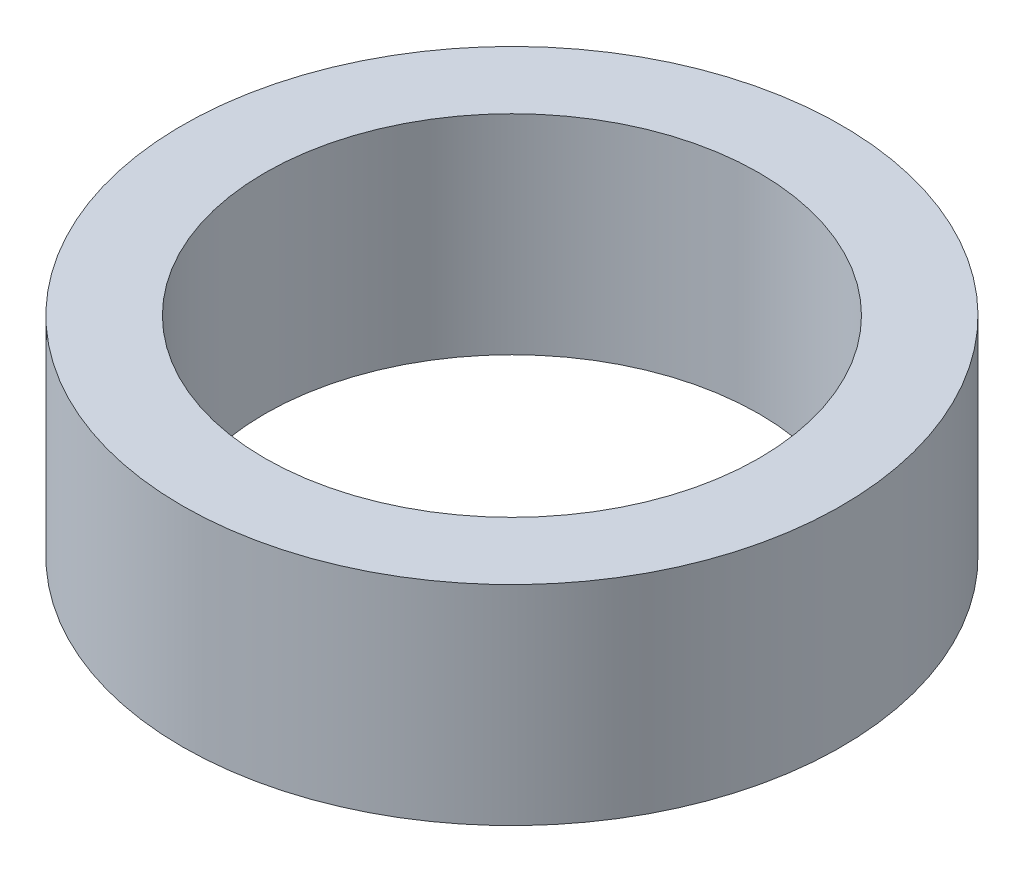
from build123d import *

# Parameters (mm, degrees)
SKETCH1_R           = 30
BOSS_EXTRUDE1_DEPTH = 19
SKETCH2_R           = 22.5
CUT_EXTRUDE1_DEPTH  = 47.486557197


with BuildPart() as part:
    # Sketch1 → Boss-Extrude1 (new body)
    with BuildSketch(Plane(origin=(0, 0, 0), x_dir=(1, 0, 0), z_dir=(0, 1, 0))):
        Circle(SKETCH1_R)
    extrude(amount=BOSS_EXTRUDE1_DEPTH)

    # Sketch2 → Cut-Extrude1 (cut, through all)
    with BuildSketch(Plane(origin=(0, 0, 0), x_dir=(1, 0, 0), z_dir=(0, 1, 0))):
        Circle(SKETCH2_R)
    extrude(amount=CUT_EXTRUDE1_DEPTH, mode=Mode.SUBTRACT)


solid = part.part
